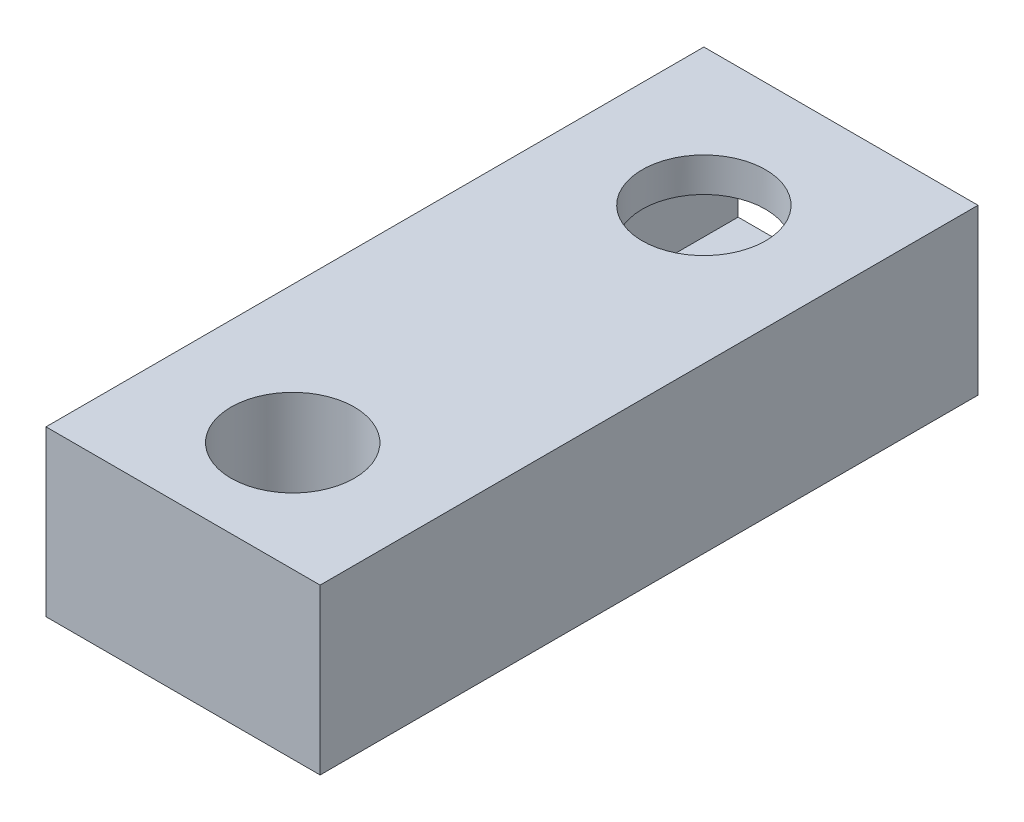
from build123d import *

# Parameters (mm, degrees)
CROQUIS1_W              = 10
CROQUIS1_H              = 6
SALIENTE_EXTRUIR1_DEPTH = 24
CROQUIS2_W              = 7.5
CROQUIS2_H              = 3.5
CORTAR_EXTRUIR1_DEPTH   = 9
CROQUIS3_R              = 2.25
CORTAR_EXTRUIR2_DEPTH   = 9
CORTAR_EXTRUIR3_DEPTH   = 10


with BuildPart() as part:
    # Croquis1 → Saliente-Extruir1 (new body)
    with BuildSketch(Plane.XY):
        Rectangle(CROQUIS1_W, CROQUIS1_H)
    extrude(amount=SALIENTE_EXTRUIR1_DEPTH)

    # Croquis2 → Cortar-Extruir1 (cut)
    with BuildSketch(Plane(origin=(0, 0, 0), x_dir=(-1, 0, 0), z_dir=(0, 0, -1))):
        Rectangle(CROQUIS2_W, CROQUIS2_H)
    extrude(amount=-CORTAR_EXTRUIR1_DEPTH, mode=Mode.SUBTRACT)

    # Croquis3 → Cortar-Extruir2 (cut)
    with BuildSketch(Plane(origin=(0, 3, 0), x_dir=(1, 0, 0), z_dir=(0, 1, 0))):
        with Locations((0, -20)):
            Circle(CROQUIS3_R)
    extrude(amount=-CORTAR_EXTRUIR2_DEPTH, mode=Mode.SUBTRACT)

    # Croquis4 → Cortar-Extruir3 (cut)
    with BuildSketch(Plane.XZ.offset(3)):
        with BuildLine():
            ThreePointArc((0, 2.75), (1.590990258, 3.409009742), (2.25, 5))
            ThreePointArc((2.25, 5), (-1.590990258, 6.590990258), (0, 2.75))
        make_face()
    extrude(amount=-CORTAR_EXTRUIR3_DEPTH, mode=Mode.SUBTRACT)


solid = part.part
